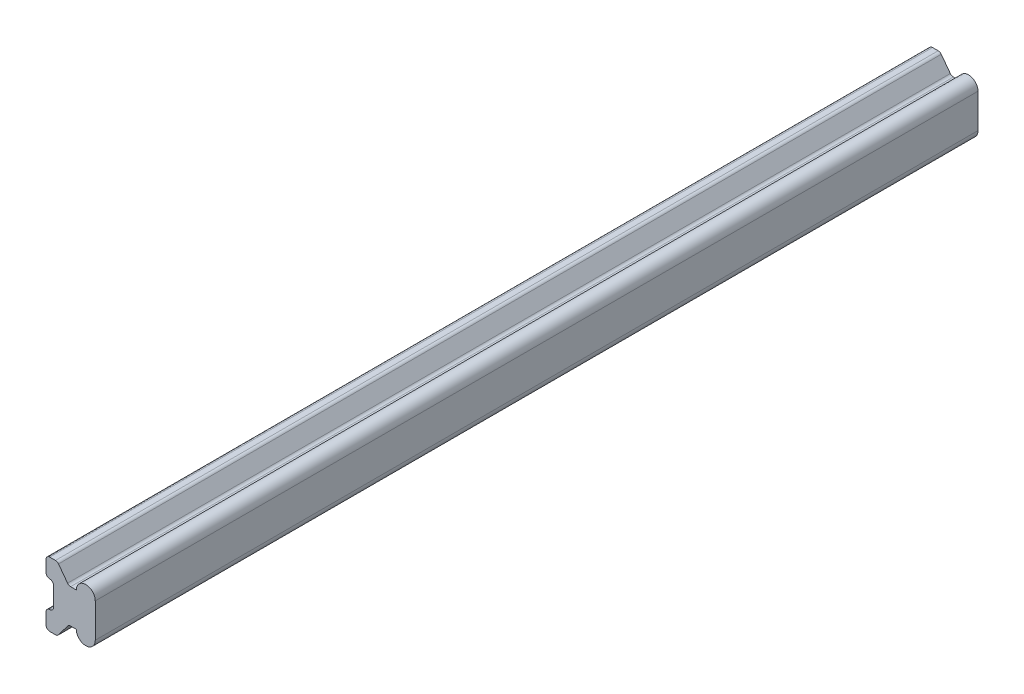
from build123d import *

# Parameters (mm, degrees)
BOSS_EXTRUDE1_DEPTH = 233
FILLET1_R           = 1


with BuildPart() as part:
    # Sketch1 → Boss-Extrude1 (new body)
    with BuildSketch(Plane.XY):
        with BuildLine():
            Line((0, 0), (0, 3.5))
            Line((0, 3.5), (-2, 3.5))
            Line((-2, 3.5), (-2, 8.5))
            Line((-2, 8.5), (1, 8.5))
            Line((1, 8.5), (4, 4.5))
            Line((4, 4.5), (6, 4.5))
            ThreePointArc((6, 4.5), (8.5, 7), (11, 4.5))
            Line((11, 4.5), (11, 0))
            Line((11, 0), (11, -4.5))
            ThreePointArc((11, -4.5), (8.5, -7), (6, -4.5))
            Line((6, -4.5), (4, -4.5))
            Line((4, -4.5), (1, -8.5))
            Line((1, -8.5), (-2, -8.5))
            Line((-2, -8.5), (-2, -3.5))
            Line((-2, -3.5), (0, -3.5))
            Line((0, -3.5), (0, 0))
        make_face()
    extrude(amount=BOSS_EXTRUDE1_DEPTH)

    # Fillet1
    fillet1_edges = [part.edges().sort_by_distance(p)[0] for p in [
        (4, -4.5, 116.5),
        (1, -8.5, 116.5),
        (-2, -8.5, 116.5),
        (-2, -3.5, 116.5),
        (0, -3.5, 116.5),
        (0, 3.5, 116.5),
        (-2, 3.5, 116.5),
        (-2, 8.5, 116.5),
        (1, 8.5, 116.5),
        (4, 4.5, 116.5),
    ]]
    fillet(fillet1_edges, radius=FILLET1_R - 0.0001)  # a hair under: the kernel refuses the full size


solid = part.part
